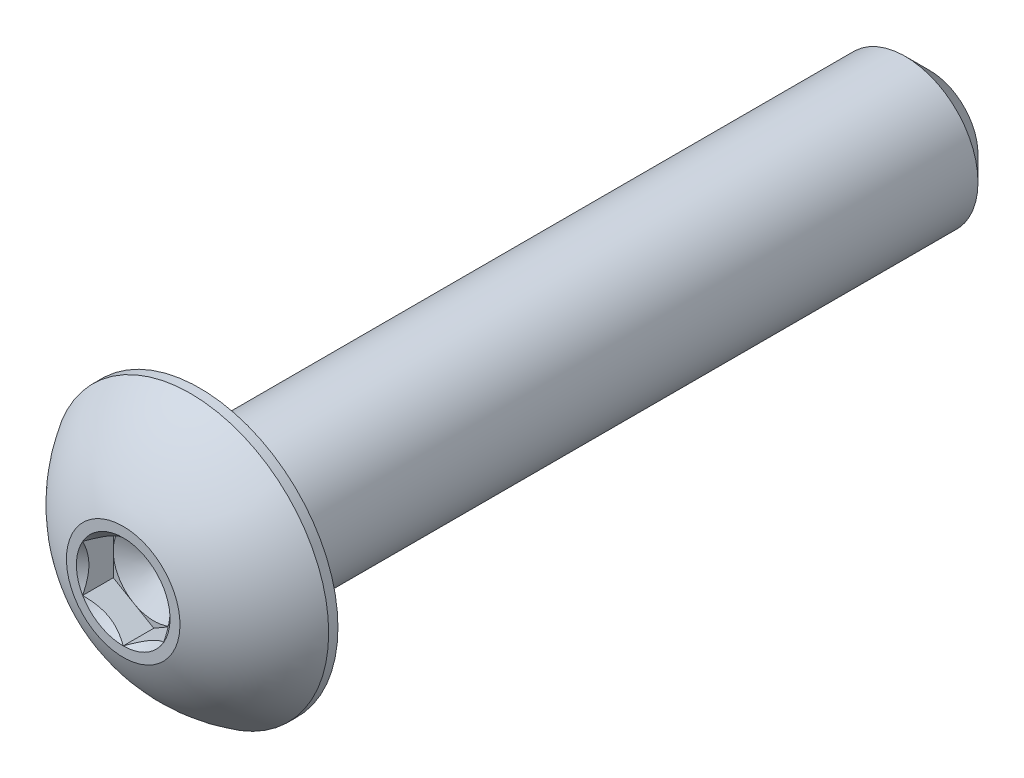
from build123d import *

# Parameters (mm, degrees)
CUT_EXTRUDE1_START = 7.29361
CUT_EXTRUDE1_DEPTH = 2.477670997


# Read off the part's stored shape, not the designer's step: Split1
with BuildPart() as part:
    # Sketch2 → Revolve1 (revolve)
    with BuildSketch(Plane(origin=(0, 0, 0), x_dir=(0, 0, -1), z_dir=(1, 0, 0)), mode=Mode.PRIVATE) as revolve1_sk:
        with BuildLine():
            Line((-7.89305, 0.79375), (-7.89305, 1.11125))
            ThreePointArc((-7.89305, 1.11125), (-7.36812089, 2.018629974), (-6.575878571, 2.7051))
            Line((-6.575878571, 2.7051), (-6.39445, 2.7051))
            Line((-6.39445, 2.7051), (-6.39445, 1.4224))
            Line((-6.39445, 1.4224), (7.4168, 1.4224))
            Line((7.4168, 1.4224), (7.89305, 0.94615))
            Line((7.89305, 0.94615), (7.89305, 0))
            Line((7.89305, 0), (-6.835338224, 0))
            Line((-6.835338224, 0), (-7.29361, 0.79375))
            Line((-7.29361, 0.79375), (-7.89305, 0.79375))
        make_face()
    revolve(revolve1_sk.sketch.rotate(Axis((0, 0, 7.89305), (0, 0, -1)), 90), axis=Axis((0, 0, 7.89305), (0, 0, -1)))

    # Sketch3 → Cut-Extrude1 (cut, through all)
    with BuildSketch(Plane.XY.offset(CUT_EXTRUDE1_START)):
        Polygon((0, 0.916543552), (-0.79375, 0.458271776), (-0.79375, -0.458271776), (0, -0.916543552), (0.79375, -0.458271776), (0.79375, 0.458271776), align=None)
    extrude(amount=CUT_EXTRUDE1_DEPTH, mode=Mode.SUBTRACT)

    # Cut-Extrude2 cone 1 section (through the dimple's axis) → Cut-Extrude2 (revolve, cut)
    with BuildSketch(Plane(origin=(0, 0, 7.89305), x_dir=(0, -1, 0), z_dir=(1, 0, 0))):
        Polygon((0, 0), (0.916543552, 0), (0, 0.916543552), align=None)
    revolve(axis=Axis((0, 0, 7.89305), (0, 0, -1)), mode=Mode.SUBTRACT)


with BuildPart() as body_2:
    # Split1: the piece on the far side of the plane
    add(part.part)
    split(bisect_by=Plane.XY.offset(6.39445), keep=Keep.BOTTOM)


with BuildPart() as part_1:
    add(part.part)

    # Split1
    split(bisect_by=Plane.XY.offset(6.39445), keep=Keep.TOP)

    add(body_2.part)  # Boss-Extrude1 merges body 2
    # Boss-Extrude1 cone 1 section (through the dimple's axis) → Boss-Extrude1 (revolve)
    with BuildSketch(Plane(origin=(0, 0, 6.39445), x_dir=(0, -1, 0), z_dir=(1, 0, 0))):
        Polygon((0, 0), (1.429512, 0), (0, 2.475987414), align=None)
    revolve(axis=Axis((0, 0, 6.39445), (0, 0, -1)))


solid = part_1.part
